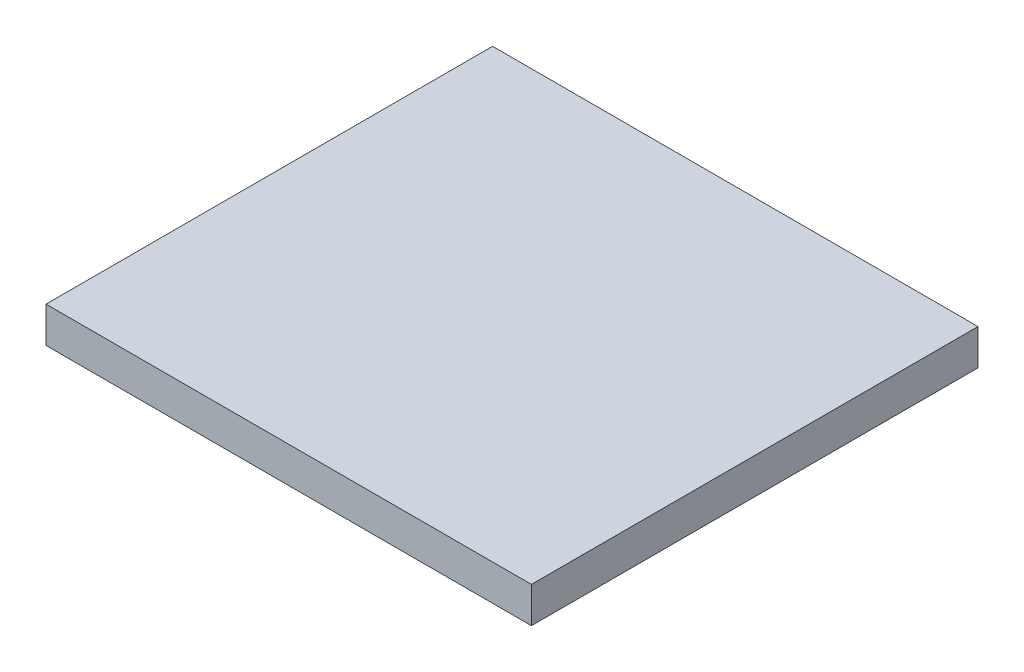
from build123d import *

# Parameters (mm, degrees)
SKETCH1_W               = 125
SKETCH1_H               = 115
TEST_BASE_POSTION_DEPTH = 9.215


with BuildPart() as part:
    # Sketch1 → Test_Base_Postion (new body)
    with BuildSketch(Plane(origin=(0, 0, 0), x_dir=(1, 0, 0), z_dir=(0, 1, 0))):
        Rectangle(SKETCH1_W, SKETCH1_H)
    extrude(amount=TEST_BASE_POSTION_DEPTH)


solid = part.part
